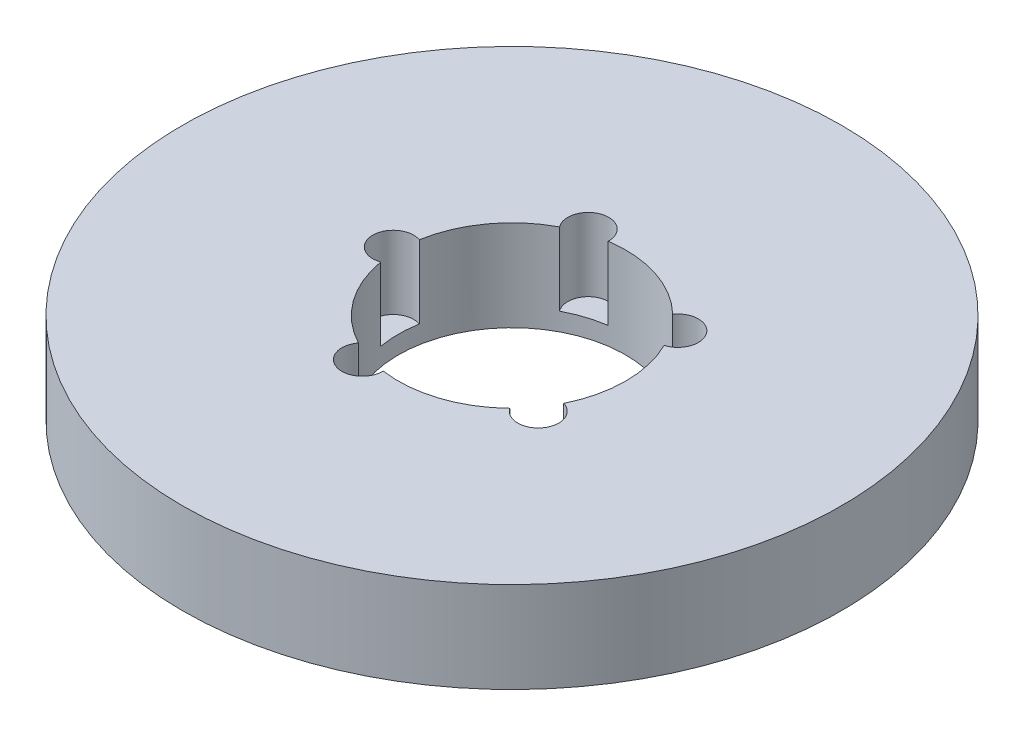
from build123d import *

# Parameters (mm, degrees)
SKETCH1_R           = 72.5
BOSS_EXTRUDE1_DEPTH = 20
SKETCH2_R           = 25
CUT_EXTRUDE1_DEPTH  = 105.462912079
SKETCH3_R           = 4.502727737
CUT_EXTRUDE2_DEPTH  = 16.053468559
CIRPATTERN1_COUNT   = 5


with BuildPart() as part:
    # Sketch1 → Boss-Extrude1 (new body)
    with BuildSketch(Plane(origin=(0, 0, 0), x_dir=(1, 0, 0), z_dir=(0, 1, 0))):
        Circle(SKETCH1_R)
    extrude(amount=BOSS_EXTRUDE1_DEPTH)

    # Sketch2 → Cut-Extrude1 (cut, through all)
    with BuildSketch(Plane(origin=(0, 0, 0), x_dir=(1, 0, 0), z_dir=(0, 1, 0))):
        Circle(SKETCH2_R)
    extrude(amount=CUT_EXTRUDE1_DEPTH, mode=Mode.SUBTRACT)

    # Sketch3 → Cut-Extrude2 (cut)
    with BuildSketch(Plane(origin=(0, 20, 0), x_dir=(1, 0, 0), z_dir=(0, 1, 0))):
        with Locations((-26.130877429, 0)):
            Circle(SKETCH3_R)
    cut_extrude2 = extrude(amount=-CUT_EXTRUDE2_DEPTH, mode=Mode.SUBTRACT)

    # CirPattern1: Cut-Extrude2 ×5 about axis
    cirpattern1_axis = Axis((0, 0, 0), (0, 1, 0))
    for i in range(1, CIRPATTERN1_COUNT):
        add(cut_extrude2.rotate(cirpattern1_axis, i * 360 / CIRPATTERN1_COUNT), mode=Mode.SUBTRACT)


solid = part.part
